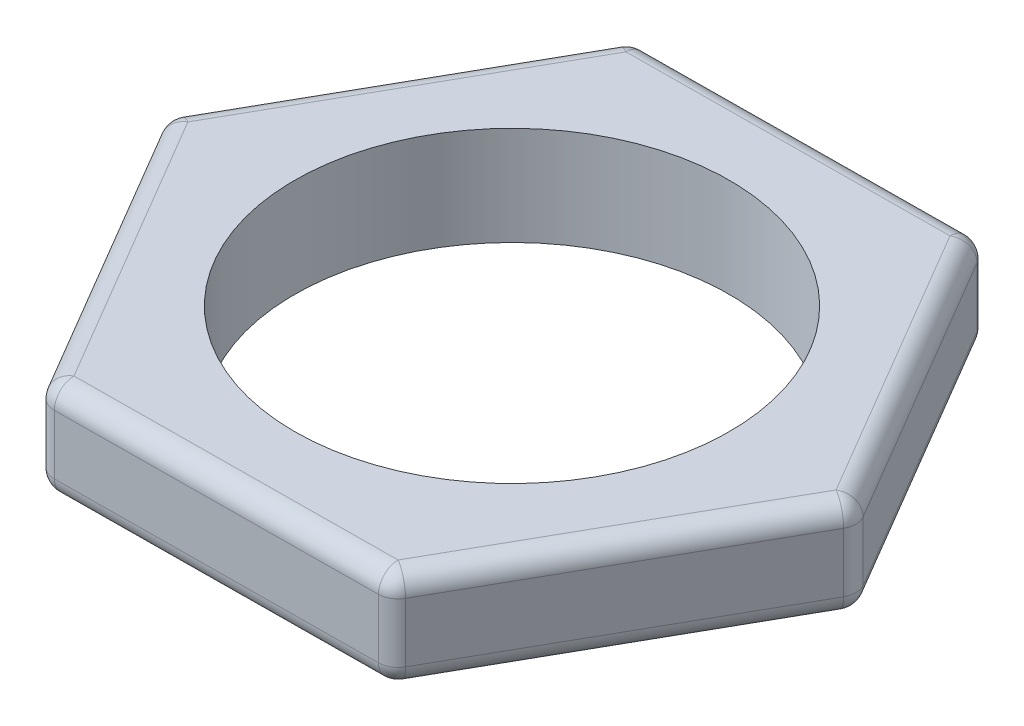
from build123d import *

# Parameters (mm, degrees)
SKETCH1_R           = 11
BOSS_EXTRUDE1_DEPTH = 5
FILLET1_R           = 1
FILLET2_R           = 1
FILLET3_R           = 1
FILLET4_R           = 1
FILLET5_R           = 1
FILLET6_R           = 1
FILLET7_R           = 1
FILLET8_R           = 1


with BuildPart() as part:
    # Sketch1 → Boss-Extrude1 (new body)
    with BuildSketch(Plane(origin=(0, 0, 0), x_dir=(1, 0, 0), z_dir=(0, 1, 0))):
        Polygon((8.83016903, -15), (17.405465572, 0.1471507), (8.575296542, 15.1471507), (-8.83016903, 15), (-17.405465572, -0.1471507), (-8.575296542, -15.1471507), align=None)
        with Locations(Location((0, 0, 0), (0, 0, 270))):
            Circle(SKETCH1_R, mode=Mode.SUBTRACT)
    extrude(amount=BOSS_EXTRUDE1_DEPTH)

    # Fillet1
    fillet1_edges = [part.edges().sort_by_distance(p)[0] for p in [
        (-12.990381057, 0, 7.6471507),
        (-13.117817301, 0, -7.42642465),
        (-0.127436244, 0, -15.07357535),
        (12.990381057, 0, -7.6471507),
        (13.117817301, 0, 7.42642465),
        (0.127436244, 0, 15.07357535),
    ]]
    fillet(fillet1_edges, radius=FILLET1_R)

    # Fillet2
    fillet2_edges = [part.edges().sort_by_distance(p)[0] for p in [
        (12.990381057, 5, -7.6471507),
        (-0.127436244, 5, -15.07357535),
        (-13.117817301, 5, -7.42642465),
        (-12.990381057, 5, 7.6471507),
        (0.127436244, 5, 15.07357535),
        (13.117817301, 5, 7.42642465),
    ]]
    fillet(fillet2_edges, radius=FILLET2_R)

    # Fillet3
    # the kernel refuses this fillet: 1 mm, written as the material it takes off along each edge
    with BuildSketch(Plane(origin=(8.244385414, 1, 14.004916643), x_dir=(0.870221445448491, 0, 0.4926607716081514), z_dir=(0, -1, 0))) as fillet3_piece_1_section:
        Polygon((0, 0), (FILLET3_R, 0), (FILLET3_R, FILLET3_R * 0.57735026919), (FILLET3_R * 0.5, FILLET3_R * 0.866025403784), align=None)
    fillet3_piece_1 = extrude(amount=FILLET3_R, mode=Mode.PRIVATE)
    fillet3_piece_1 = fillet3_piece_1 - Plane(origin=(8.244385414, 1, 14.004916643), x_dir=(-0.5073034928723316, 0, -0.8617674663849478), z_dir=(0, -1, 0)) * Sphere(FILLET3_R, mode=Mode.PRIVATE)
    add(fillet3_piece_1, mode=Mode.SUBTRACT)
    with BuildSketch(Plane(origin=(8.244385414, 4, 14.004916643), x_dir=(0.870221445448491, 0, 0.4926607716081514), z_dir=(0, 1, 0))) as fillet3_piece_2_section:
        Polygon((0, 0), (FILLET3_R, 0), (FILLET3_R, -FILLET3_R * 0.57735026919), (FILLET3_R * 0.5, -FILLET3_R * 0.866025403784), align=None)
    fillet3_piece_2 = extrude(amount=FILLET3_R, mode=Mode.PRIVATE)
    fillet3_piece_2 = fillet3_piece_2 - Plane(origin=(8.244385414, 4, 14.004916643), x_dir=(-0.5073034928723316, 0, -0.8617674663849478), z_dir=(0, 1, 0)) * Sphere(FILLET3_R, mode=Mode.PRIVATE)
    add(fillet3_piece_2, mode=Mode.SUBTRACT)
    with BuildSketch(Plane(origin=(8.83016903, 1, 15), x_dir=(0.4926607716081517, 0, -0.8702214454484907), z_dir=(0, 1, 0))) as fillet3_piece_3:
        with BuildLine():
            CenterArc((FILLET3_R * 0.57735026919, FILLET3_R), FILLET3_R, 210, 60)
            Line((-FILLET3_R * 0.288675134595, FILLET3_R * 0.5), (0, 0))
            Line((0, 0), (FILLET3_R * 0.57735026919, 0))
        make_face()
    extrude(amount=3, mode=Mode.SUBTRACT)

    # Fillet4
    # the kernel refuses this fillet: 1 mm, written as the material it takes off along each edge
    with BuildSketch(Plane(origin=(-8.006420883, 1, 14.142305528), x_dir=(0.008453979063543083, 0, 0.999964264480483), z_dir=(0, -1, 0))) as fillet4_piece_1_section:
        Polygon((0, 0), (FILLET4_R, 0), (FILLET4_R, FILLET4_R * 0.57735026919), (FILLET4_R * 0.5, FILLET4_R * 0.866025403784), align=None)
    fillet4_piece_1 = extrude(amount=FILLET4_R, mode=Mode.PRIVATE)
    fillet4_piece_1 = fillet4_piece_1 - Plane(origin=(-8.006420883, 1, 14.142305528), x_dir=(0.49266077160815147, 0, -0.870221445448491), z_dir=(0, -1, 0)) * Sphere(FILLET4_R, mode=Mode.PRIVATE)
    add(fillet4_piece_1, mode=Mode.SUBTRACT)
    with BuildSketch(Plane(origin=(-8.006420883, 4, 14.142305528), x_dir=(0.008453979063543083, 0, 0.999964264480483), z_dir=(0, 1, 0))) as fillet4_piece_2_section:
        Polygon((0, 0), (FILLET4_R, 0), (FILLET4_R, -FILLET4_R * 0.57735026919), (FILLET4_R * 0.5, -FILLET4_R * 0.866025403784), align=None)
    fillet4_piece_2 = extrude(amount=FILLET4_R, mode=Mode.PRIVATE)
    fillet4_piece_2 = fillet4_piece_2 - Plane(origin=(-8.006420883, 4, 14.142305528), x_dir=(0.49266077160815147, 0, -0.870221445448491), z_dir=(0, 1, 0)) * Sphere(FILLET4_R, mode=Mode.PRIVATE)
    add(fillet4_piece_2, mode=Mode.SUBTRACT)
    with BuildSketch(Plane(origin=(-8.575296542, 1, 15.1471507), x_dir=(0.9999642644804829, 0, -0.008453979063542578), z_dir=(0, 1, 0))) as fillet4_piece_3:
        with BuildLine():
            CenterArc((FILLET4_R * 0.57735026919, FILLET4_R), FILLET4_R, 210, 60)
            Line((-FILLET4_R * 0.288675134595, FILLET4_R * 0.5), (0, 0))
            Line((0, 0), (FILLET4_R * 0.57735026919, 0))
        make_face()
    extrude(amount=3, mode=Mode.SUBTRACT)

    # Fillet5
    # the kernel refuses this fillet: 1 mm, written as the material it takes off along each edge
    with BuildSketch(Plane(origin=(-16.250806297, 1, 0.137388886), x_dir=(-0.870221445448491, 0, -0.49266077160815136), z_dir=(0, -1, 0))) as fillet5_piece_1_section:
        Polygon((0, 0), (FILLET5_R, 0), (FILLET5_R, -FILLET5_R * 0.57735026919), (FILLET5_R * 0.5, -FILLET5_R * 0.866025403784), align=None)
    fillet5_piece_1 = extrude(amount=FILLET5_R, mode=Mode.PRIVATE)
    fillet5_piece_1 = fillet5_piece_1 - Plane(origin=(-16.250806297, 1, 0.137388886), x_dir=(0.9999642644804829, 0, -0.008453979063543034), z_dir=(0, -1, 0)) * Sphere(FILLET5_R, mode=Mode.PRIVATE)
    add(fillet5_piece_1, mode=Mode.SUBTRACT)
    with BuildSketch(Plane(origin=(-16.250806297, 4, 0.137388886), x_dir=(-0.870221445448491, 0, -0.49266077160815136), z_dir=(0, 1, 0))) as fillet5_piece_2_section:
        Polygon((0, 0), (FILLET5_R, 0), (FILLET5_R, FILLET5_R * 0.57735026919), (FILLET5_R * 0.5, FILLET5_R * 0.866025403784), align=None)
    fillet5_piece_2 = extrude(amount=FILLET5_R, mode=Mode.PRIVATE)
    fillet5_piece_2 = fillet5_piece_2 - Plane(origin=(-16.250806297, 4, 0.137388886), x_dir=(0.9999642644804829, 0, -0.008453979063543034), z_dir=(0, 1, 0)) * Sphere(FILLET5_R, mode=Mode.PRIVATE)
    add(fillet5_piece_2, mode=Mode.SUBTRACT)
    with BuildSketch(Plane(origin=(-17.405465572, 1, 0.1471507), x_dir=(0.4926607716081488, 0, -0.8702214454484924), z_dir=(0, 1, 0))) as fillet5_piece_3:
        with BuildLine():
            CenterArc((FILLET5_R * 0.57735026919, -FILLET5_R), FILLET5_R, 90, 60)
            Line((-FILLET5_R * 0.288675134595, -FILLET5_R * 0.5), (0, 0))
            Line((0, 0), (FILLET5_R * 0.57735026919, 0))
        make_face()
    extrude(amount=3, mode=Mode.SUBTRACT)

    # Fillet6
    # the kernel refuses this fillet: 1 mm, written as the material it takes off along each edge
    with BuildSketch(Plane(origin=(-8.244385414, 1, -14.004916643), x_dir=(-0.008453979063543077, 0, -0.9999642644804829), z_dir=(0, -1, 0))) as fillet6_piece_1_section:
        Polygon((0, 0), (FILLET6_R, 0), (FILLET6_R, -FILLET6_R * 0.57735026919), (FILLET6_R * 0.5, -FILLET6_R * 0.866025403784), align=None)
    fillet6_piece_1 = extrude(amount=FILLET6_R, mode=Mode.PRIVATE)
    fillet6_piece_1 = fillet6_piece_1 - Plane(origin=(-8.244385414, 1, -14.004916643), x_dir=(0.5073034928723316, 0, 0.8617674663849478), z_dir=(0, -1, 0)) * Sphere(FILLET6_R, mode=Mode.PRIVATE)
    add(fillet6_piece_1, mode=Mode.SUBTRACT)
    with BuildSketch(Plane(origin=(-8.244385414, 4, -14.004916643), x_dir=(-0.008453979063543077, 0, -0.9999642644804829), z_dir=(0, 1, 0))) as fillet6_piece_2_section:
        Polygon((0, 0), (FILLET6_R, 0), (FILLET6_R, FILLET6_R * 0.57735026919), (FILLET6_R * 0.5, FILLET6_R * 0.866025403784), align=None)
    fillet6_piece_2 = extrude(amount=FILLET6_R, mode=Mode.PRIVATE)
    fillet6_piece_2 = fillet6_piece_2 - Plane(origin=(-8.244385414, 4, -14.004916643), x_dir=(0.5073034928723316, 0, 0.8617674663849478), z_dir=(0, 1, 0)) * Sphere(FILLET6_R, mode=Mode.PRIVATE)
    add(fillet6_piece_2, mode=Mode.SUBTRACT)
    with BuildSketch(Plane(origin=(-8.83016903, 1, -15), x_dir=(0.9999642644804829, 0, -0.008453979063542578), z_dir=(0, 1, 0))) as fillet6_piece_3:
        with BuildLine():
            CenterArc((FILLET6_R * 0.57735026919, -FILLET6_R), FILLET6_R, 90, 60)
            Line((-FILLET6_R * 0.288675134595, -FILLET6_R * 0.5), (0, 0))
            Line((0, 0), (FILLET6_R * 0.57735026919, 0))
        make_face()
    extrude(amount=3, mode=Mode.SUBTRACT)

    # Fillet7
    # the kernel refuses this fillet: 1 mm, written as the material it takes off along each edge
    with BuildSketch(Plane(origin=(8.006420883, 1, -14.142305528), x_dir=(0.8617674663849478, 0, -0.5073034928723317), z_dir=(0, -1, 0))) as fillet7_piece_1_section:
        Polygon((0, 0), (FILLET7_R, 0), (FILLET7_R, -FILLET7_R * 0.57735026919), (FILLET7_R * 0.5, -FILLET7_R * 0.866025403784), align=None)
    fillet7_piece_1 = extrude(amount=FILLET7_R, mode=Mode.PRIVATE)
    fillet7_piece_1 = fillet7_piece_1 - Plane(origin=(8.006420883, 1, -14.142305528), x_dir=(-0.4926607716081513, 0, 0.870221445448491), z_dir=(0, -1, 0)) * Sphere(FILLET7_R, mode=Mode.PRIVATE)
    add(fillet7_piece_1, mode=Mode.SUBTRACT)
    with BuildSketch(Plane(origin=(8.006420883, 4, -14.142305528), x_dir=(0.8617674663849478, 0, -0.5073034928723317), z_dir=(0, 1, 0))) as fillet7_piece_2_section:
        Polygon((0, 0), (FILLET7_R, 0), (FILLET7_R, FILLET7_R * 0.57735026919), (FILLET7_R * 0.5, FILLET7_R * 0.866025403784), align=None)
    fillet7_piece_2 = extrude(amount=FILLET7_R, mode=Mode.PRIVATE)
    fillet7_piece_2 = fillet7_piece_2 - Plane(origin=(8.006420883, 4, -14.142305528), x_dir=(-0.4926607716081513, 0, 0.870221445448491), z_dir=(0, 1, 0)) * Sphere(FILLET7_R, mode=Mode.PRIVATE)
    add(fillet7_piece_2, mode=Mode.SUBTRACT)
    with BuildSketch(Plane(origin=(8.575296542, 1, -15.1471507), x_dir=(0.507303492872331, 0, 0.8617674663849483), z_dir=(0, 1, 0))) as fillet7_piece_3:
        with BuildLine():
            CenterArc((FILLET7_R * 0.57735026919, -FILLET7_R), FILLET7_R, 90, 60)
            Line((-FILLET7_R * 0.288675134595, -FILLET7_R * 0.5), (0, 0))
            Line((0, 0), (FILLET7_R * 0.57735026919, 0))
        make_face()
    extrude(amount=3, mode=Mode.SUBTRACT)

    # Fillet8
    # the kernel refuses this fillet: 1 mm, written as the material it takes off along each edge
    with BuildSketch(Plane(origin=(16.250806297, 1, -0.137388886), x_dir=(0.870221445448491, 0, 0.4926607716081514), z_dir=(0, -1, 0))) as fillet8_piece_1_section:
        Polygon((0, 0), (FILLET8_R, 0), (FILLET8_R, -FILLET8_R * 0.57735026919), (FILLET8_R * 0.5, -FILLET8_R * 0.866025403784), align=None)
    fillet8_piece_1 = extrude(amount=FILLET8_R, mode=Mode.PRIVATE)
    fillet8_piece_1 = fillet8_piece_1 - Plane(origin=(16.250806297, 1, -0.137388886), x_dir=(-0.9999642644804829, 0, 0.00845397906354313), z_dir=(0, -1, 0)) * Sphere(FILLET8_R, mode=Mode.PRIVATE)
    add(fillet8_piece_1, mode=Mode.SUBTRACT)
    with BuildSketch(Plane(origin=(16.250806297, 4, -0.137388886), x_dir=(0.870221445448491, 0, 0.4926607716081514), z_dir=(0, 1, 0))) as fillet8_piece_2_section:
        Polygon((0, 0), (FILLET8_R, 0), (FILLET8_R, FILLET8_R * 0.57735026919), (FILLET8_R * 0.5, FILLET8_R * 0.866025403784), align=None)
    fillet8_piece_2 = extrude(amount=FILLET8_R, mode=Mode.PRIVATE)
    fillet8_piece_2 = fillet8_piece_2 - Plane(origin=(16.250806297, 4, -0.137388886), x_dir=(-0.9999642644804829, 0, 0.00845397906354313), z_dir=(0, 1, 0)) * Sphere(FILLET8_R, mode=Mode.PRIVATE)
    add(fillet8_piece_2, mode=Mode.SUBTRACT)
    with BuildSketch(Plane(origin=(17.405465572, 1, -0.1471507), x_dir=(-0.4926607716081509, 0, 0.8702214454484912), z_dir=(0, 1, 0))) as fillet8_piece_3:
        with BuildLine():
            CenterArc((FILLET8_R * 0.57735026919, -FILLET8_R), FILLET8_R, 90, 60)
            Line((-FILLET8_R * 0.288675134595, -FILLET8_R * 0.5), (0, 0))
            Line((0, 0), (FILLET8_R * 0.57735026919, 0))
        make_face()
    extrude(amount=3, mode=Mode.SUBTRACT)


solid = part.part
